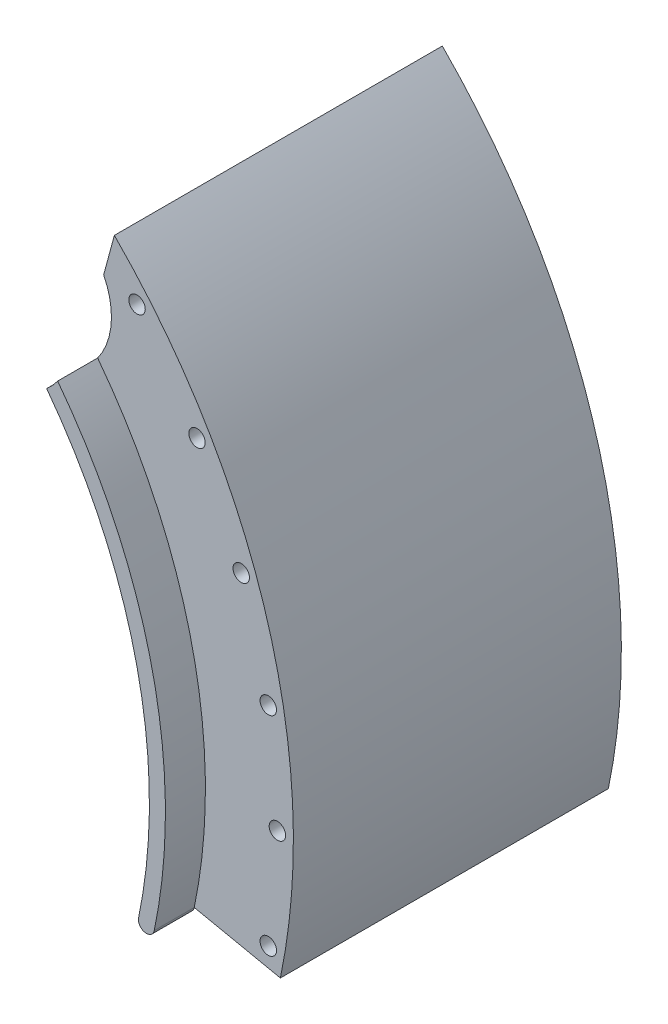
from build123d import *

# Parameters (mm, degrees)
BOSS_EXTRUDE2_DEPTH     = 15.875
SKETCH3_R               = 3.2639
BOSS_EXTRUDE3_DEPTH     = 130.175
CUT_EXTRUDE1_DEPTH      = 333.857457489
CUT_EXTRUDE1_DEPTH_BACK = 333.857457489
SKETCH4_R               = 28.575


with BuildPart() as part:
    # Sketch1 → Boss-Extrude2 (new body)
    with BuildSketch(Plane.XY):
        with BuildLine():
            ThreePointArc((160.517658678, 124.596634194), (192.233488554, 65.852303515), (203.2, 0))
            ThreePointArc((203.2, 0), (202.123085284, -20.892544009), (198.903755953, -41.563636364))
            ThreePointArc((198.903755953, -41.563636364), (201.362195322, -45.320939369), (205.119498327, -42.8625))
            ThreePointArc((205.119498327, -42.8625), (208.439431699, -21.545436009), (209.55, 0))
            ThreePointArc((209.55, 0), (198.240785071, 67.910188), (165.533835512, 128.490279013))
            ThreePointArc((165.533835512, 128.490279013), (161.078924686, 129.05154502), (160.517658678, 124.596634194))
        make_face()
    boss_extrude2 = extrude(amount=BOSS_EXTRUDE2_DEPTH)

    # Sketch3 → Boss-Extrude3 (add)
    with BuildSketch(Plane.XY.offset(15.875)):
        with BuildLine():
            Line((198.903755953, -41.563636364), (239.306081381, -50.00625))
            ThreePointArc((239.306081381, -50.00625), (238.201271239, 55.028901542), (193.122808097, 149.905325515))
            ThreePointArc((193.122808097, 149.905325515), (183.61109394, 161.41558725), (173.414436378, 172.323703769))
            Line((173.414436378, 172.323703769), (160.517658678, 124.596634194))
            ThreePointArc((160.517658678, 124.596634194), (197.985472199, 45.738307776), (198.903755953, -41.563636364))
        make_face()
        with Locations((238.125, 0)):
            Circle(SKETCH3_R, mode=Mode.SUBTRACT)
        with Locations((234.507346186, 41.349972307)):
            Circle(SKETCH3_R, mode=Mode.SUBTRACT)
        with Locations((223.764305325, 81.443546629)):
            Circle(SKETCH3_R, mode=Mode.SUBTRACT)
        with Locations((206.222299276, 119.0625)):
            Circle(SKETCH3_R, mode=Mode.SUBTRACT)
        with Locations((182.414333018, 153.063799557)):
            Circle(SKETCH3_R, mode=Mode.SUBTRACT)
        with Locations((234.507346186, -41.349972307)):
            Circle(SKETCH3_R, mode=Mode.SUBTRACT)
    extrude(amount=BOSS_EXTRUDE3_DEPTH)

    # Mirror1: Boss-Extrude2 across plane
    add(boss_extrude2.mirror(Plane(origin=(0, 0, 80.9625), x_dir=(1, 0, 0), z_dir=(0, 0, -1))))

    # Sketch4 → Cut-Extrude1 (cut, two sides: drawn at the far end of the back side and taken through both)
    with BuildSketch(Plane.XY.offset(146.05).offset(-CUT_EXTRUDE1_DEPTH_BACK)):
        with Locations((143.684097937, 143.684097937)):
            Circle(SKETCH4_R)
    extrude(amount=CUT_EXTRUDE1_DEPTH + CUT_EXTRUDE1_DEPTH_BACK, mode=Mode.SUBTRACT)


solid = part.part
